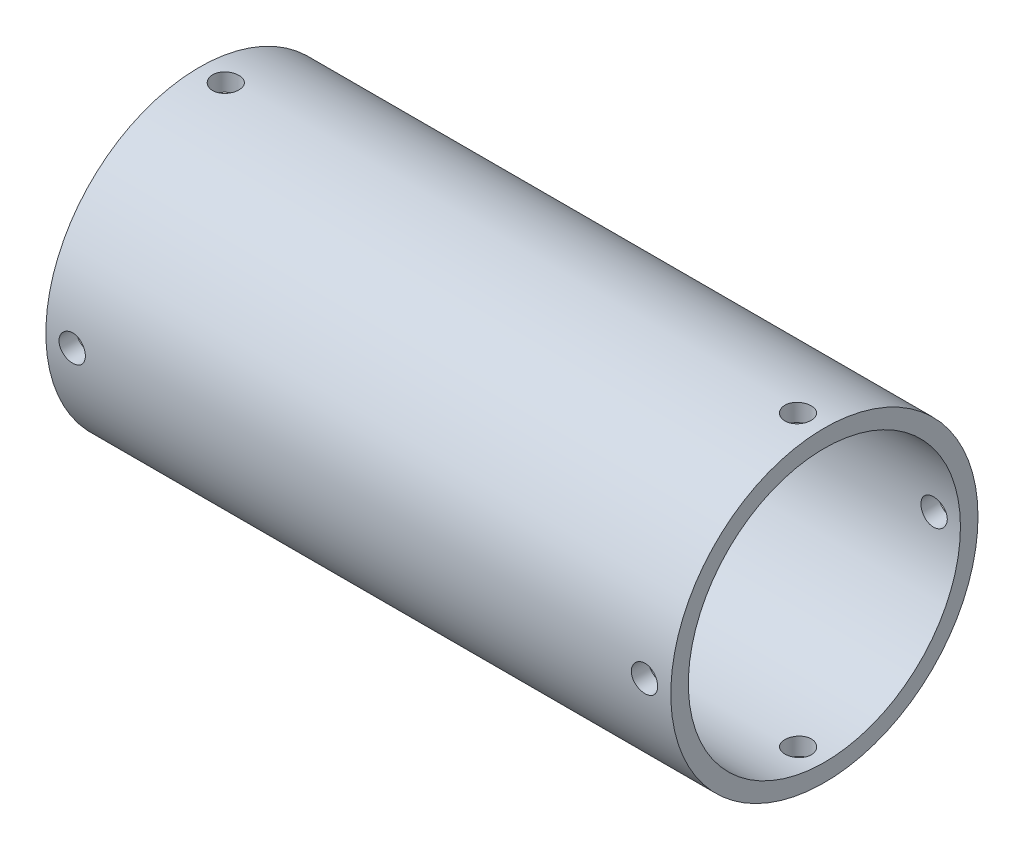
from build123d import *

# Parameters (mm, degrees)
SKETCH_1_R               = 17.5
SKETCH_1_R_2             = 15.5
EXTRUDE_1_DEPTH          = 71.2
SKETCH_2_R               = 1.5
CUT_EXTRUDE_1_DEPTH      = 76.378644191
PATTERN_CIRCULAR_1_COUNT = 2
PATTERN_CIRCULAR_1_ANGLE = 90


with BuildPart() as part:
    # Эскиз1 → Бобышка-Вытянуть1 (new body)
    with BuildSketch(Plane(origin=(0, 0, 0), x_dir=(0, 0, -1), z_dir=(1, 0, 0))):
        Circle(SKETCH_1_R)
        Circle(SKETCH_1_R_2, mode=Mode.SUBTRACT)
    extrude(amount=EXTRUDE_1_DEPTH)

    # Эскиз2 → Вырез-Вытянуть1 (cut, symmetric)
    with BuildSketch(Plane.XY):
        with Locations((3, 0)):
            Circle(SKETCH_2_R)
        with Locations((68.2, 0)):
            Circle(SKETCH_2_R)
    cut_extrude_1 = extrude(amount=CUT_EXTRUDE_1_DEPTH, both=True, mode=Mode.SUBTRACT)

    # Круговой массив1: Вырез-Вытянуть1 ×2 about axis
    pattern_circular_1_axis = Axis((9.527991342, 0, 0), (1, 0, 0))
    for i in range(1, PATTERN_CIRCULAR_1_COUNT):
        add(cut_extrude_1.rotate(pattern_circular_1_axis, i * PATTERN_CIRCULAR_1_ANGLE / (PATTERN_CIRCULAR_1_COUNT - 1)), mode=Mode.SUBTRACT)


solid = part.part
